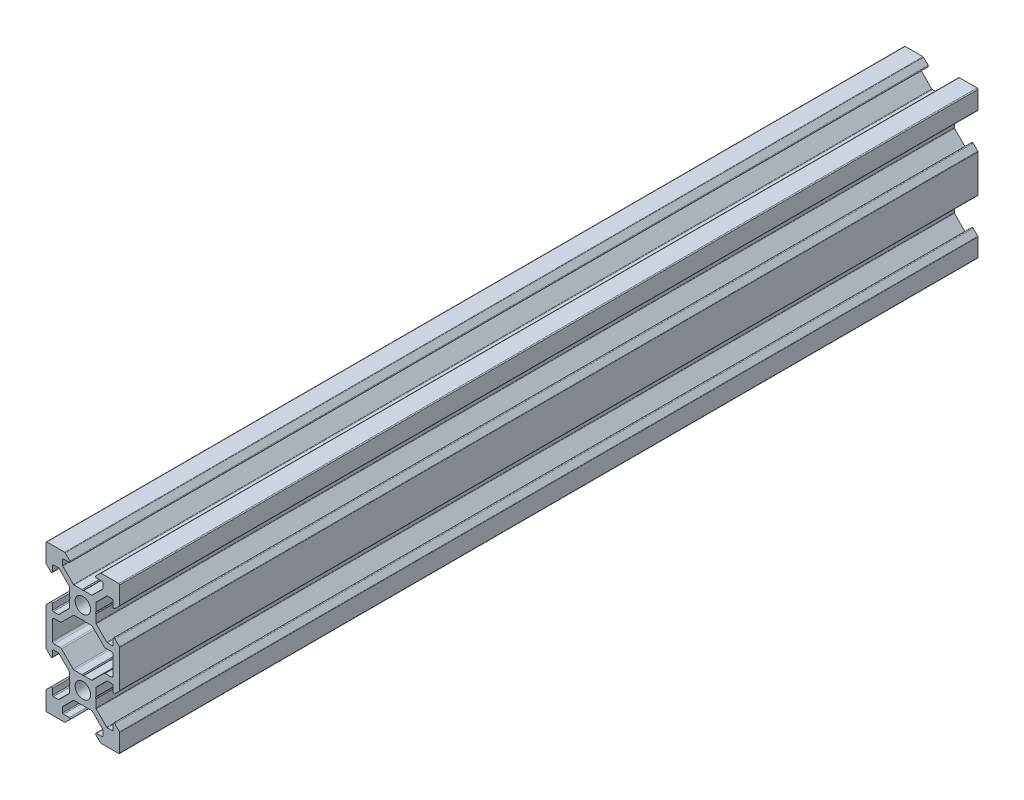
from build123d import *

# Parameters (mm, degrees)
SKETCH1_R           = 2.1
BOSS_EXTRUDE1_DEPTH = 233.04
FILLET1_R           = 0.25
FILLET2_R           = 0.5
CUT_EXTRUDE1_DEPTH  = 236.175767459


with BuildPart() as part:
    # Sketch1 → Boss-Extrude1 (new body)
    with BuildSketch(Plane.XY):
        Polygon((3.560660172, -2.5), (3.560660172, 2.5), (6.560660172, 5.5), (8.252142372, 5.5), (8.252142372, 3.1), (10, 4.847857628), (10, 10), (4.847857628, 10), (3.1, 8.252142372), (5.5, 8.252142372), (5.5, 6.560660172), (2.5, 3.560660172), (-2.5, 3.560660172), (-5.5, 6.560660172), (-5.5, 8.252142372), (-3.1, 8.252142372), (-4.847857628, 10), (-10, 10), (-10, 4.847857628), (-8.252142372, 3.1), (-8.252142372, 5.5), (-6.560660172, 5.5), (-3.560660172, 2.5), (-3.560660172, -2.5), (-6.560660172, -5.5), (-8.252142372, -5.5), (-8.252142372, -3.1), (-10, -4.847857628), (-10, -7), (-10, -13), (-10, -15.152142372), (-8.252142372, -16.9), (-8.252142372, -14.5), (-6.560660172, -14.5), (-3.560660172, -17.5), (-3.560660172, -22.5), (-6.560660172, -25.5), (-8.252142372, -25.5), (-8.252142372, -23.1), (-10, -24.847857628), (-10, -30), (-4.847857628, -30), (-3.1, -28.252142372), (-5.5, -28.252142372), (-5.5, -26.560660172), (-2.5, -23.560660172), (2.5, -23.560660172), (5.5, -26.560660172), (5.5, -28.252142372), (3.1, -28.252142372), (4.847857628, -30), (10, -30), (10, -24.847857628), (8.252142372, -23.1), (8.252142372, -25.5), (6.560660172, -25.5), (3.560660172, -22.5), (3.560660172, -17.5), (6.560660172, -14.5), (8.252142372, -14.5), (8.252142372, -16.9), (10, -15.152142372), (10, -13), (10, -7), (10, -4.847857628), (8.252142372, -3.1), (8.252142372, -5.5), (6.560660172, -5.5), align=None)
        Circle(SKETCH1_R, mode=Mode.SUBTRACT)
        with Locations((0, -20)):
            Circle(SKETCH1_R, mode=Mode.SUBTRACT)
        Polygon((2.5, -3.560660172), (-2.5, -3.560660172), (-5.5, -6.560660172), (-5.939339828, -7), (-8.252142372, -7), (-8.252142372, -13), (-5.939339828, -13), (-5.5, -13.439339828), (-2.5, -16.439339828), (2.5, -16.439339828), (5.5, -13.439339828), (5.939339828, -13), (8.252142372, -13), (8.252142372, -7), (5.939339828, -7), (5.5, -6.560660172), align=None, mode=Mode.SUBTRACT)
    extrude(amount=BOSS_EXTRUDE1_DEPTH)

    # Fillet1
    fillet1_edges = [part.edges().sort_by_distance(p)[0] for p in [
        (5.5, 6.560660172, 116.52),
        (5.5, 8.252142372, 116.52),
        (3.1, 8.252142372, 116.52),
        (4.847857628, 10, 116.52),
        (10, 10, 116.52),
        (10, 4.847857628, 116.52),
        (8.252142372, 3.1, 116.52),
        (8.252142372, 5.5, 116.52),
        (6.560660172, 5.5, 116.52),
        (3.560660172, 2.5, 116.52),
        (3.560660172, -2.5, 116.52),
        (6.560660172, -5.5, 116.52),
        (8.252142372, -5.5, 116.52),
        (8.252142372, -3.1, 116.52),
        (10, -4.847857628, 116.52),
        (10, -15.152142372, 116.52),
        (8.252142372, -16.9, 116.52),
        (8.252142372, -14.5, 116.52),
        (6.560660172, -14.5, 116.52),
        (3.560660172, -17.5, 116.52),
        (3.560660172, -22.5, 116.52),
        (6.560660172, -25.5, 116.52),
        (8.252142372, -25.5, 116.52),
        (8.252142372, -23.1, 116.52),
        (10, -24.847857628, 116.52),
        (10, -30, 116.52),
        (4.847857628, -30, 116.52),
        (3.1, -28.252142372, 116.52),
        (5.5, -28.252142372, 116.52),
        (5.5, -26.560660172, 116.52),
        (2.5, -23.560660172, 116.52),
        (-2.5, -23.560660172, 116.52),
        (-5.5, -26.560660172, 116.52),
        (-5.5, -28.252142372, 116.52),
        (-3.1, -28.252142372, 116.52),
        (-4.847857628, -30, 116.52),
        (-10, -30, 116.52),
        (-10, -24.847857628, 116.52),
        (-8.252142372, -23.1, 116.52),
        (-8.252142372, -25.5, 116.52),
        (-6.560660172, -25.5, 116.52),
        (-3.560660172, -22.5, 116.52),
        (-3.560660172, -17.5, 116.52),
        (-6.560660172, -14.5, 116.52),
        (-8.252142372, -14.5, 116.52),
        (-8.252142372, -16.9, 116.52),
        (-10, -15.152142372, 116.52),
        (-10, -4.847857628, 116.52),
        (-8.252142372, -3.1, 116.52),
        (-8.252142372, -5.5, 116.52),
        (-6.560660172, -5.5, 116.52),
        (-3.560660172, -2.5, 116.52),
        (-3.560660172, 2.5, 116.52),
        (-6.560660172, 5.5, 116.52),
        (-8.252142372, 5.5, 116.52),
        (-8.252142372, 3.1, 116.52),
        (-10, 4.847857628, 116.52),
        (-10, 10, 116.52),
        (-4.847857628, 10, 116.52),
        (-5.5, 8.252142372, 116.52),
        (-5.5, 6.560660172, 116.52),
        (-2.5, 3.560660172, 116.52),
        (2.5, 3.560660172, 116.52),
        (-3.1, 8.252142372, 116.52),
    ]]
    fillet(fillet1_edges, radius=FILLET1_R)

    # Fillet2
    fillet2_edges = [part.edges().sort_by_distance(p)[0] for p in [
        (-5.939339828, -7, 116.52),
        (-8.252142372, -7, 116.52),
        (-8.252142372, -13, 116.52),
        (-5.939339828, -13, 116.52),
        (-2.5, -16.439339828, 116.52),
        (2.5, -16.439339828, 116.52),
        (8.252142372, -7, 116.52),
        (5.939339828, -7, 116.52),
        (2.5, -3.560660172, 116.52),
        (-2.5, -3.560660172, 116.52),
        (5.939339828, -13, 116.52),
        (8.252142372, -13, 116.52),
    ]]
    fillet(fillet2_edges, radius=FILLET2_R)

    # Sketch2 → Cut-Extrude1 (cut, through all)
    with BuildSketch(Plane.XY.offset(233.04)):
        Polygon((0, 3.398953432), (-0.242280927, 3.560660172), (0.242280927, 3.560660172), align=None)
        Polygon((0, -3.398953432), (0.242280927, -3.560660172), (-0.242280927, -3.560660172), align=None)
        Polygon((3.560660172, 0.242280927), (3.560660172, -0.242280927), (3.398953432, 0), align=None)
        Polygon((-3.560660172, 0.242280927), (-3.560660172, -0.242280927), (-3.398953432, 0), align=None)
        Polygon((-3.398953432, -20), (-3.560660172, -20.242280927), (-3.560660172, -19.757719073), align=None)
        Polygon((3.398953432, -20), (3.560660172, -19.757719073), (3.560660172, -20.242280927), align=None)
        Polygon((-0.242280927, -16.439339828), (0.242280927, -16.439339828), (0, -16.601046568), align=None)
        Polygon((-0.242280927, -23.560660172), (0.242280927, -23.560660172), (0, -23.398953432), align=None)
    extrude(amount=-CUT_EXTRUDE1_DEPTH, mode=Mode.SUBTRACT)


solid = part.part
